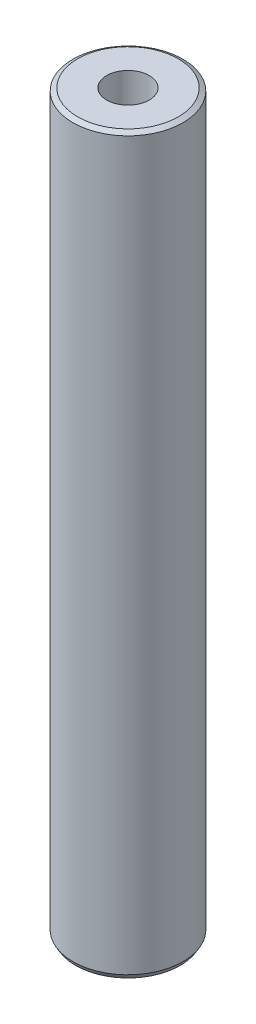
from build123d import *
from OCP.BRepFilletAPI import BRepFilletAPI_MakeChamfer

# Parameters (mm, degrees)
SKETCH1_R           = 45
BOSS_EXTRUDE1_DEPTH = 600
SKETCH2_R           = 17.413768004
CUT_EXTRUDE1_DEPTH  = 604.365560834
CHAMFER1_SIZE       = 2.223301327
CHAMFER1_SIZE2      = 3.850870859


with BuildPart() as part:
    # Sketch1 → Boss-Extrude1 (new body)
    with BuildSketch(Plane(origin=(0, 0, 0), x_dir=(1, 0, 0), z_dir=(0, 1, 0))):
        Circle(SKETCH1_R)
    extrude(amount=BOSS_EXTRUDE1_DEPTH)

    # Sketch2 → Cut-Extrude1 (cut, through all)
    with BuildSketch(Plane(origin=(0, 0, 0), x_dir=(1, 0, 0), z_dir=(0, 1, 0))):
        Circle(SKETCH2_R)
    extrude(amount=CUT_EXTRUDE1_DEPTH, mode=Mode.SUBTRACT)

    # Chamfer1: one chamfer whose edges measure the first distance from different faces: ONE call of the kernel's chamfer builder (chamfer() names one face for all edges)
    chamfer1_edges_1 = [part.edges().sort_by_distance(p)[0] for p in [
        (-45, 600, 0),
    ]]
    chamfer1_side_1 = [part.faces().sort_by_distance(p)[0] for p in [
        (-45, 300, 0),
    ]]
    chamfer1_edges_2 = [part.edges().sort_by_distance(p)[0] for p in [
        (-45, 0, 0),
    ]]
    chamfer1_side_2 = [part.faces().sort_by_distance(p)[0] for p in [
        (-43.727207794, 0, 0),
    ]]
    chamfer1 = BRepFilletAPI_MakeChamfer(part.part.solid().wrapped)
    for e in chamfer1_edges_1:
        chamfer1.Add(CHAMFER1_SIZE, CHAMFER1_SIZE2, e.wrapped, chamfer1_side_1[0].wrapped)  # the first distance lies on this face
    for e in chamfer1_edges_2:
        chamfer1.Add(CHAMFER1_SIZE, CHAMFER1_SIZE2, e.wrapped, chamfer1_side_2[0].wrapped)  # the first distance lies on this face
    add(Compound.cast(chamfer1.Shape()), mode=Mode.REPLACE)


solid = part.part
